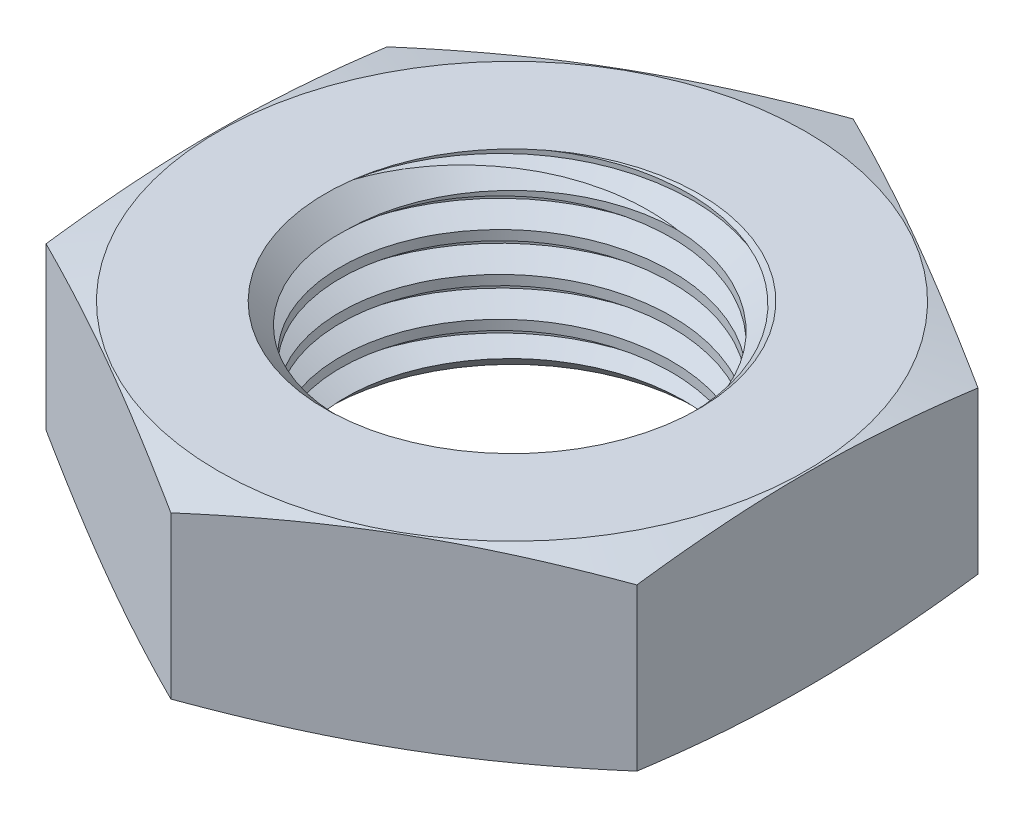
from build123d import *

# Parameters (mm, degrees)
CUT_EXTRUDE1_DEPTH      = 7
CUT_EXTRUDE1_DEPTH_BACK = 7
SKETCH2_W               = 76
SKETCH2_H               = 76
THREAD1_PITCH           = 1.25


with BuildPart() as part:
    # Sketch1 → Revolve1 (revolve)
    with BuildSketch(Plane.XY, mode=Mode.PRIVATE) as revolve1_sk:
        Polygon((0, 0), (9.45, 0), (20.646152423, -3), (9.45, -6), (0, -6), align=None)
    revolve(revolve1_sk.sketch.rotate(Axis((0, -6, 0), (0, 1, 0)), 90), axis=Axis((0, -6, 0), (0, 1, 0)))

    # Sketch2 → Cut-Extrude1 (cut, two sides: drawn at the far end of the back side and taken through both)
    with BuildSketch(Plane(origin=(0, 0, 0), x_dir=(1, 0, 0), z_dir=(0, 1, 0)).offset(-CUT_EXTRUDE1_DEPTH_BACK)):
        Rectangle(SKETCH2_W, SKETCH2_H)
        Polygon((-9.5, -5.484827557), (0, -10.969655115), (9.5, -5.484827557), (9.5, 5.484827557), (0, 10.969655115), (-9.5, 5.484827557), align=None, mode=Mode.SUBTRACT)
    extrude(amount=CUT_EXTRUDE1_DEPTH + CUT_EXTRUDE1_DEPTH_BACK, mode=Mode.SUBTRACT)

    # Sketch3 → Cut-Revolve1 (revolve, cut)
    with BuildSketch(Plane.XY, mode=Mode.PRIVATE) as cut_revolve1_sk:
        Polygon((0, 0), (6, 0), (5.3235, -0.6765), (5.3235, -5.3235), (6, -6), (0, -6), align=None)
    revolve(cut_revolve1_sk.sketch.rotate(Axis((0, -6, 0), (0, 1, 0)), 270), axis=Axis((0, -6, 0), (0, 1, 0)), mode=Mode.SUBTRACT)

    # Thread1: the profile of Thread Profile1 profile screwed along a right-hand helix of 20 turns, 8 arcs to a turn; built about Z, then put on its axis
    thread1_z = Axis((0, 0, 0), (0, 0, 1))
    thread1_corners = [(5.3232, 0, -0.000173205), (6.000082344, 0, 0.390624998), (6.000082344, 0, 0.546874998), (5.3232, 0, 0.937673202)]
    with BuildLine(mode=Mode.PRIVATE) as thread1_profile:
        Line(thread1_corners[0], thread1_corners[1])
        Line(thread1_corners[1], thread1_corners[2])
        Line(thread1_corners[2], thread1_corners[3])
        Line(thread1_corners[3], thread1_corners[0])
    thread1_cap = Face(thread1_profile.wire())
    thread1_turn_angles = [0, 22.5, 45, 67.5, 90, 112.5, 135, 157.5, 180, 202.5, 225, 247.5, 270, 292.5, 315, 337.5, 360]
    thread1_turn_weights = [1, 0.9238795325112867, 1, 0.9238795325112867, 1, 0.9238795325112867, 1, 0.9238795325112867, 1, 0.9238795325112867, 1, 0.9238795325112867, 1, 0.9238795325112867, 1, 0.9238795325112867, 1]
    thread1_turn_rails = [Edge.make_bspline([Vector(p[0], p[1], 0).rotate(thread1_z, thread1_turn_angles[k]) / thread1_turn_weights[k] + Vector(0, 0, p[2] + THREAD1_PITCH * thread1_turn_angles[k] / 360) for k in range(17)], [0, 0, 0, 1, 1, 2, 2, 3, 3, 4, 4, 5, 5, 6, 6, 7, 7, 8, 8, 8], 2, thread1_turn_weights) for p in thread1_corners]
    thread1_turn_sides = [Face.make_surface_from_curves(thread1_turn_rails[p[0]], thread1_turn_rails[p[1]]) for p in [(0, 1), (1, 2), (2, 3), (3, 0)]]
    thread1 = Plane(origin=(0, 4.3235, 0), x_dir=(-1, 0, 0), z_dir=(0, -1, 0)) * Solid(Shell([*[p.moved(Location((0, 0, THREAD1_PITCH * i))) for i in range(20) for p in thread1_turn_sides], thread1_cap, thread1_cap.rotate(thread1_z, 7200).moved(Location((0, 0, THREAD1_PITCH * 7200 / 360)))]))
    add(thread1, mode=Mode.SUBTRACT)


solid = part.part
